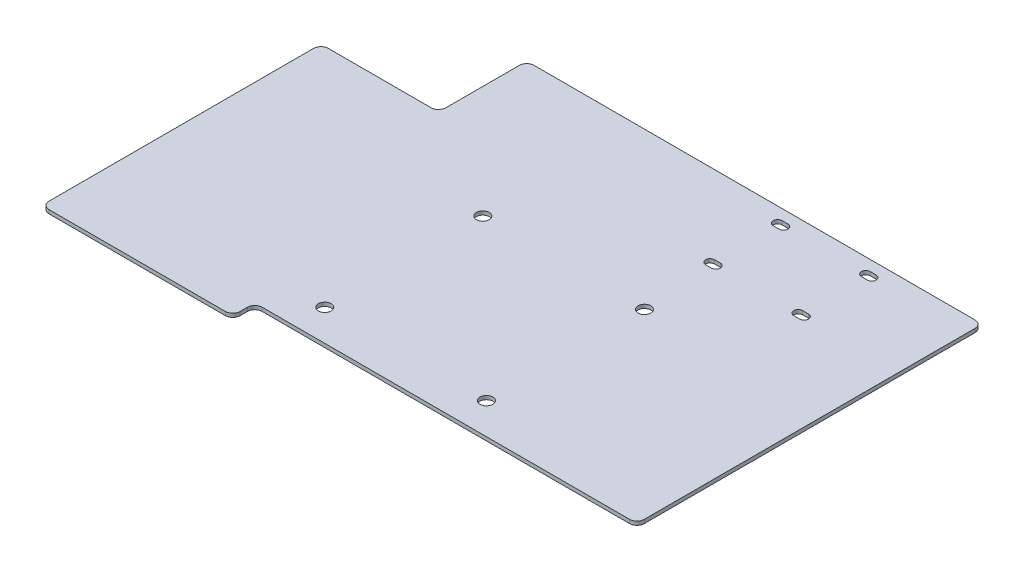
from build123d import *

# Parameters (mm, degrees)
BOSS_EXTRUDE1_DEPTH            = 1.6002
SKETCH3_W                      = 165.1
SKETCH3_H                      = 9.525
CUT_EXTRUDE1_DEPTH             = 295.167716856
FILLET1_R                      = 3.175
FUSE_ZIPTIE_MOUNTS_DEPTH       = 295.167716856
SKETCH5_R                      = 2.75
CONTACTOR_MOUNTING_HOLES_DEPTH = 295.167716856


with BuildPart() as part:
    # Sketch1 → Boss-Extrude1 (new body)
    with BuildSketch(Plane(origin=(0, 0, 0), x_dir=(1, 0, 0), z_dir=(0, 1, 0))):
        Polygon((0, 120.65), (0, 0), (247.65, 0), (247.65, 158.75), (50.8, 158.75), (50.8, 120.65), align=None)
    extrude(amount=BOSS_EXTRUDE1_DEPTH)

    # Sketch3 → Cut-Extrude1 (cut, through all)
    with BuildSketch(Plane(origin=(0, 1.6002, 0), x_dir=(1, 0, 0), z_dir=(0, 1, 0))):
        with Locations((165.1, 4.7625)):
            Rectangle(SKETCH3_W, SKETCH3_H)
    extrude(amount=-CUT_EXTRUDE1_DEPTH, mode=Mode.SUBTRACT)

    # Fillet1
    fillet1_edges = [part.edges().sort_by_distance(p)[0] for p in [
        (82.55, 0.8001, 0),
        (0, 0.8001, -120.65),
        (50.8, 0.8001, -120.65),
        (50.8, 0.8001, -158.75),
        (247.65, 0.8001, -158.75),
        (247.65, 0.8001, -9.525),
        (82.55, 0.8001, -9.525),
        (0, 0.8001, 0),
    ]]
    fillet(fillet1_edges, radius=FILLET1_R)

    # Sketch4 → Fuse Ziptie Mounts (cut, through all)
    with BuildSketch(Plane(origin=(0, 1.6002, 0), x_dir=(1, 0, 0), z_dir=(0, 1, 0))):
        with BuildLine():
            Line((165.653, 154.225), (168.193, 154.225))
            ThreePointArc((168.193, 154.225), (170.098, 152.32), (168.193, 150.415))
            Line((168.193, 150.415), (165.653, 150.415))
            ThreePointArc((165.653, 150.415), (163.748, 152.32), (165.653, 154.225))
        make_face()
        with BuildLine():
            Line((203.753, 154.225), (206.293, 154.225))
            ThreePointArc((206.293, 154.225), (208.198, 152.32), (206.293, 150.415))
            Line((206.293, 150.415), (203.753, 150.415))
            ThreePointArc((203.753, 150.415), (201.848, 152.32), (203.753, 154.225))
        make_face()
        with BuildLine():
            Line((203.753, 125.015), (206.293, 125.015))
            ThreePointArc((206.293, 125.015), (208.198, 123.11), (206.293, 121.205))
            Line((206.293, 121.205), (203.753, 121.205))
            ThreePointArc((203.753, 121.205), (201.848, 123.11), (203.753, 125.015))
        make_face()
        with BuildLine():
            Line((165.653, 125.015), (168.193, 125.015))
            ThreePointArc((168.193, 125.015), (170.098, 123.11), (168.193, 121.205))
            Line((168.193, 121.205), (165.653, 121.205))
            ThreePointArc((165.653, 121.205), (163.748, 123.11), (165.653, 125.015))
        make_face()
    extrude(amount=-FUSE_ZIPTIE_MOUNTS_DEPTH, mode=Mode.SUBTRACT)

    # Sketch5 → Contactor Mounting Holes (cut, through all)
    with BuildSketch(Plane(origin=(0, 1.6002, 0), x_dir=(1, 0, 0), z_dir=(0, 1, 0))):
        with Locations((99.298, 91.2876)):
            Circle(SKETCH5_R)
        with Locations((99.298, 23.0124)):
            Circle(SKETCH5_R)
        with Locations((169.148, 91.2876)):
            Circle(SKETCH5_R)
        with Locations((169.148, 23.0124)):
            Circle(SKETCH5_R)
    extrude(amount=-CONTACTOR_MOUNTING_HOLES_DEPTH, mode=Mode.SUBTRACT)


solid = part.part
